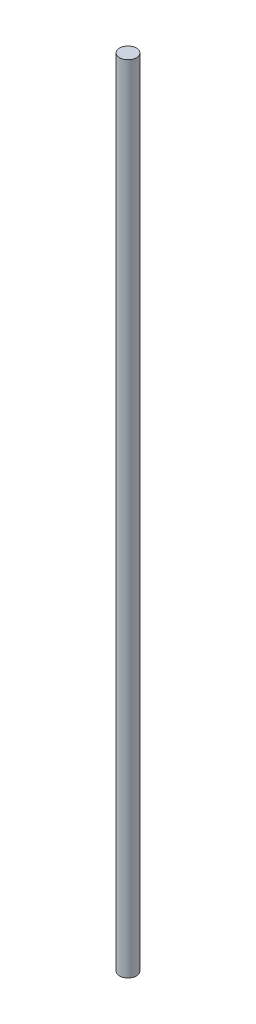
from build123d import *

# Parameters (mm, degrees)
SKETCH1_R           = 0.79375
BOSS_EXTRUDE1_DEPTH = 75


with BuildPart() as part:
    # Sketch1 → Boss-Extrude1 (new body)
    with BuildSketch(Plane(origin=(0, 0, 0), x_dir=(1, 0, 0), z_dir=(0, 1, 0))):
        Circle(SKETCH1_R)
    extrude(amount=BOSS_EXTRUDE1_DEPTH)


solid = part.part
